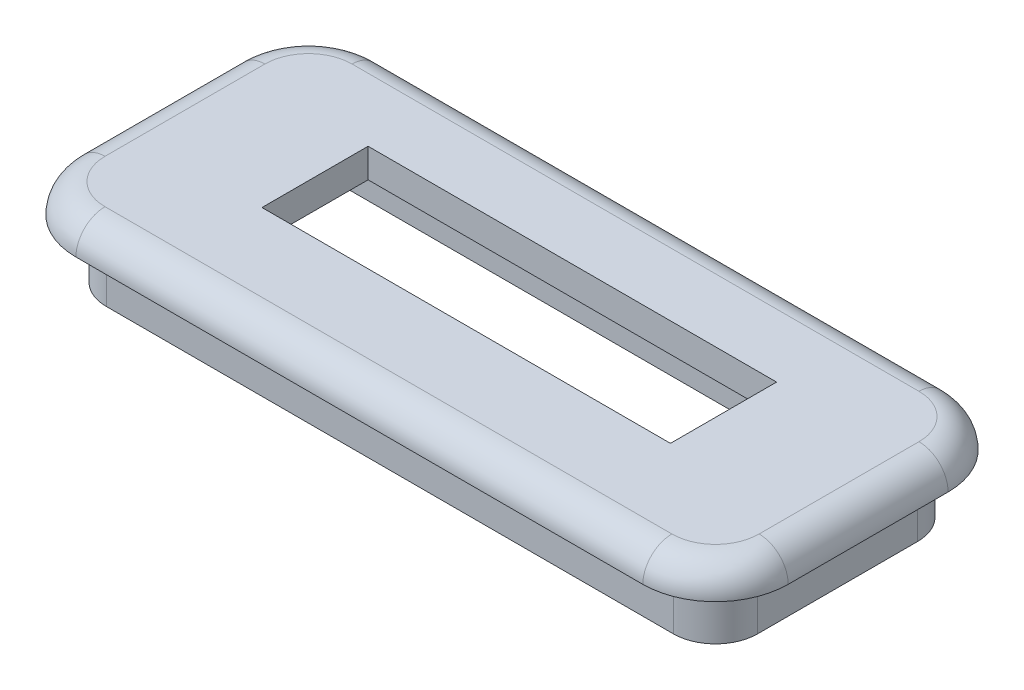
from build123d import *

# Parameters (mm, degrees)
BOSS_EXTRUDE1_DEPTH = 2
BOSS_EXTRUDE2_DEPTH = 4
SKETCH3_W           = 28.1
SKETCH3_H           = 7.3
CUT_EXTRUDE1_DEPTH  = 4
FILLET1_R           = 2


with BuildPart() as part:
    # Sketch1 → Boss-Extrude1 (new body)
    with BuildSketch(Plane(origin=(0, 0, 0), x_dir=(1, 0, 0), z_dir=(0, 1, 0))):
        with BuildLine():
            Line((-19.5, 10.5), (19.5, 10.5))
            ThreePointArc((19.5, 10.5), (23.035533906, 9.035533906), (24.5, 5.5))
            Line((24.5, 5.5), (24.5, -5.5))
            ThreePointArc((24.5, -5.5), (23.035533906, -9.035533906), (19.5, -10.5))
            Line((19.5, -10.5), (-19.5, -10.5))
            ThreePointArc((-19.5, -10.5), (-23.035533906, -9.035533906), (-24.5, -5.5))
            Line((-24.5, -5.5), (-24.5, 5.5))
            ThreePointArc((-24.5, 5.5), (-23.035533906, 9.035533906), (-19.5, 10.5))
        make_face()
    extrude(amount=BOSS_EXTRUDE1_DEPTH)

    # Sketch2 → Boss-Extrude2 (add)
    with BuildSketch(Plane.XZ):
        with BuildLine():
            Line((-22.4, 5.5), (-22.4, -5.5))
            ThreePointArc((-22.4, -5.5), (-21.550609665, -7.550609665), (-19.5, -8.4))
            Line((-19.5, -8.4), (19.5, -8.4))
            ThreePointArc((19.5, -8.4), (21.550609665, -7.550609665), (22.4, -5.5))
            Line((22.4, -5.5), (22.4, 5.5))
            ThreePointArc((22.4, 5.5), (21.550609665, 7.550609665), (19.5, 8.4))
            Line((19.5, 8.4), (-19.5, 8.4))
            ThreePointArc((-19.5, 8.4), (-21.550609665, 7.550609665), (-22.4, 5.5))
        make_face()
        with BuildLine():
            Line((-20.9, 5.5), (-20.9, -5.5))
            ThreePointArc((-20.9, -5.5), (-20.489949494, -6.489949494), (-19.5, -6.9))
            Line((-19.5, -6.9), (19.5, -6.9))
            ThreePointArc((19.5, -6.9), (20.489949494, -6.489949494), (20.9, -5.5))
            Line((20.9, -5.5), (20.9, 5.5))
            ThreePointArc((20.9, 5.5), (20.489949494, 6.489949494), (19.5, 6.9))
            Line((19.5, 6.9), (-19.5, 6.9))
            ThreePointArc((-19.5, 6.9), (-20.489949494, 6.489949494), (-20.9, 5.5))
        make_face(mode=Mode.SUBTRACT)
    extrude(amount=BOSS_EXTRUDE2_DEPTH)

    # Sketch3 → Cut-Extrude1 (cut)
    with BuildSketch(Plane(origin=(0, 2, 0), x_dir=(1, 0, 0), z_dir=(0, 1, 0))):
        with Locations((0, 0.5)):
            Rectangle(SKETCH3_W, SKETCH3_H)
    extrude(amount=-CUT_EXTRUDE1_DEPTH, mode=Mode.SUBTRACT)

    # Fillet1
    fillet1_edges = [part.edges().sort_by_distance(p)[0] for p in [
        (-23.035533906, 2, -9.035533906),
        (0, 2, -10.5),
        (23.035533906, 2, -9.035533906),
        (24.5, 2, 0),
        (23.035533906, 2, 9.035533906),
        (0, 2, 10.5),
        (-23.035533906, 2, 9.035533906),
        (-24.5, 2, 0),
    ]]
    fillet(fillet1_edges, radius=FILLET1_R - 0.0001)  # a hair under: the kernel refuses the full size


solid = part.part
